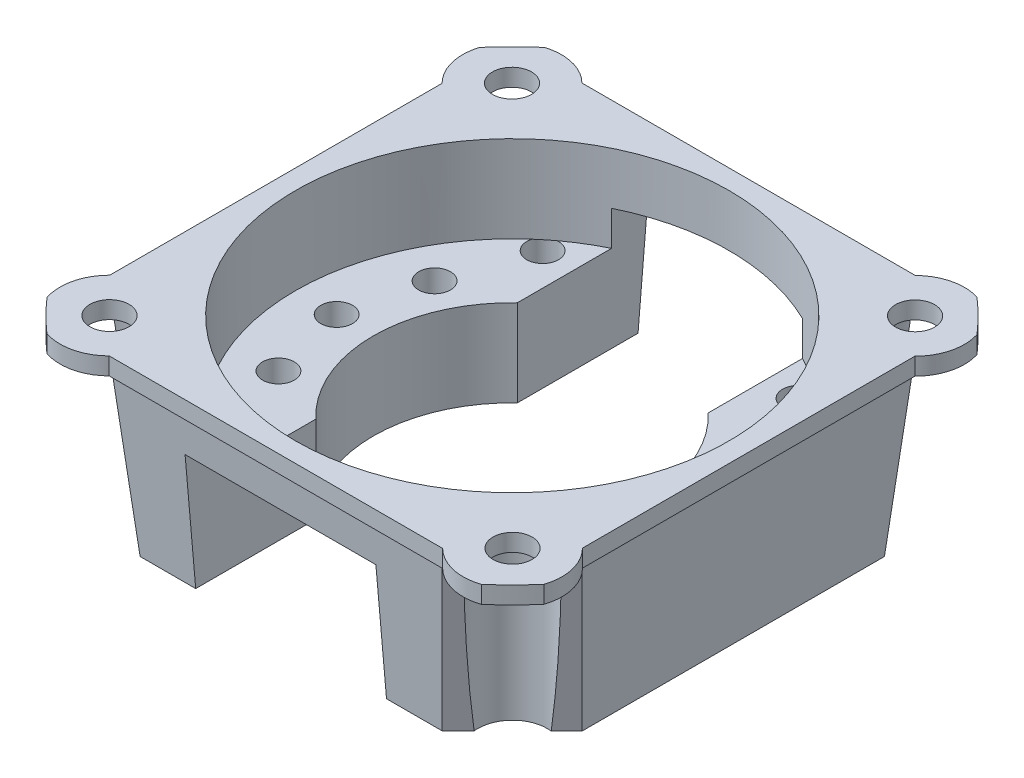
from build123d import *
from OCP.BRepFilletAPI import BRepFilletAPI_MakeChamfer

# Parameters (mm, degrees)
SKETCH1_W               = 29.5
SKETCH1_H               = 29.5
BOSS_EXTRUDE1_DEPTH     = 10
SKETCH2_R               = 12.5
CUT_EXTRUDE1_DEPTH      = 5
CHAMFER1_SIZE           = 22.860104606
CHAMFER1_SIZE_2         = 2
CHAMFER2_SIZE           = 4
CHAMFER2_SIZE2          = 4.030734246
SKETCH5_R               = 8
CUT_EXTRUDE2_DEPTH      = 10
BOSS_EXTRUDE2_START     = -1
BOSS_EXTRUDE2_DEPTH     = 1
MIRROR2_START           = -1
MIRROR2_COPY_1_DEPTH    = 1
CUT_EXTRUDE3_DEPTH      = 43.277768842
CUT_EXTRUDE3_DEPTH_BACK = 43.277768842
SKETCH7_R               = 1.125
SKETCH8_R               = 0.635
CUT_EXTRUDE4_DEPTH      = 43.501879232
SKETCH10_R              = 0.915
CUT_EXTRUDE5_DEPTH      = 2
SKETCH11_OUTSIDE_W      = 39.354
SKETCH11_OUTSIDE_H      = 39.324
SKETCH11_OUTSIDE_R      = 19
CUT_EXTRUDE6_DEPTH      = 43.501879232
SKETCH12_R              = 2
CUT_EXTRUDE7_DEPTH      = 9
SKETCH13_W              = 11
SKETCH13_H              = 30.855989766
CUT_EXTRUDE8_DEPTH      = 7


with BuildPart() as part:
    # Sketch1 → Boss-Extrude1 (new body)
    with BuildSketch(Plane(origin=(0, 0, 0), x_dir=(1, 0, 0), z_dir=(0, 1, 0))):
        with Locations((14.75, 14.75)):
            Rectangle(SKETCH1_W, SKETCH1_H)
    extrude(amount=BOSS_EXTRUDE1_DEPTH)

    # Sketch2 → Cut-Extrude1 (cut)
    with BuildSketch(Plane(origin=(0, 10, 0), x_dir=(1, 0, 0), z_dir=(0, 1, 0))):
        with Locations(Location((14.75, 14.75, 0), (0, 0, 270))):
            Circle(SKETCH2_R)
    extrude(amount=-CUT_EXTRUDE1_DEPTH, mode=Mode.SUBTRACT)

    # Chamfer1
    # the kernel refuses this chamfer: 22.860104606, 2 mm, written as the material it takes off along each edge
    with BuildSketch(Plane(origin=(-59.427907001, 0, 0), x_dir=(0, 1, 0), z_dir=(1, 0, 0)), Plane(origin=(29.5, 0, 59.427907001), x_dir=(0, 1, 0), z_dir=(0, 0, -1)), Plane(origin=(0, 0, -88.927907001), x_dir=(0, 1, 0), z_dir=(0, 0, 1))) as chamfer1_piece_1:
        Polygon((CHAMFER1_SIZE, 0), (0, -CHAMFER1_SIZE_2), (0, 0), align=None)
    extrude(amount=148.355814002, mode=Mode.SUBTRACT)
    with BuildSketch(Plane(origin=(88.927907001, 0, -29.5), x_dir=(0, 0, 1), z_dir=(-1, 0, 0))) as chamfer1_piece_2:
        Polygon((CHAMFER1_SIZE_2, 0), (0, CHAMFER1_SIZE), (0, 0), align=None)
    extrude(amount=148.355814002, mode=Mode.SUBTRACT)

    # Chamfer2: one chamfer whose edges measure the first distance from different faces: ONE call of the kernel's chamfer builder (chamfer() names one face for all edges)
    chamfer2_edges_1 = [part.edges().sort_by_distance(p)[0] for p in [
        (1.562556682, 5, -27.937443318),
        (27.937443318, 5, -27.937443318),
    ]]
    chamfer2_side_1 = [part.faces().sort_by_distance(p)[0] for p in [
        (14.75, 5.055285333, -27.942280158),
    ]]
    chamfer2_edges_2 = [part.edges().sort_by_distance(p)[0] for p in [
        (1.562556682, 5, -1.562556682),
    ]]
    chamfer2_side_2 = [part.faces().sort_by_distance(p)[0] for p in [
        (1.557719842, 5.055285333, -14.75),
    ]]
    chamfer2_edges_3 = [part.edges().sort_by_distance(p)[0] for p in [
        (27.937443318, 5, -1.562556682),
    ]]
    chamfer2_side_3 = [part.faces().sort_by_distance(p)[0] for p in [
        (27.942280158, 5.055285333, -14.75),
    ]]
    chamfer2 = BRepFilletAPI_MakeChamfer(part.part.solid().wrapped)
    for e in chamfer2_edges_1:
        chamfer2.Add(CHAMFER2_SIZE, CHAMFER2_SIZE2, e.wrapped, chamfer2_side_1[0].wrapped)  # the first distance lies on this face
    for e in chamfer2_edges_2:
        chamfer2.Add(CHAMFER2_SIZE, CHAMFER2_SIZE2, e.wrapped, chamfer2_side_2[0].wrapped)  # the first distance lies on this face
    for e in chamfer2_edges_3:
        chamfer2.Add(CHAMFER2_SIZE, CHAMFER2_SIZE2, e.wrapped, chamfer2_side_3[0].wrapped)  # the first distance lies on this face
    add(Compound.cast(chamfer2.Shape()), mode=Mode.REPLACE)

    # Sketch5 → Cut-Extrude2 (cut)
    with BuildSketch(Plane.XZ):
        with Locations(Location((14.75, -14.734574622, 0), (0, 0, 270))):
            Circle(SKETCH5_R)
    extrude(amount=-CUT_EXTRUDE2_DEPTH, mode=Mode.SUBTRACT)

    # Boss-Extrude2: read off the stored shape, not the designer's step
    # Boss-Extrude2 outline → Boss-Extrude2 (add)
    with BuildSketch(Plane(origin=(0, 10, 0), x_dir=(1, 0, 0), z_dir=(0, 1, 0)).offset(BOSS_EXTRUDE2_START)):
        with BuildLine():
            Line((1.125113365, 5.14027687), (5.171127626, 1.125113365))
            Line((5.171127626, 1.125113365), (24.328872374, 1.125113365))
            Line((24.328872374, 1.125113365), (28.374886635, 5.14027687))
            Line((28.374886635, 5.14027687), (28.374886635, 24.328872374))
            Line((28.374886635, 24.328872374), (24.35972313, 28.374886635))
            Line((24.35972313, 28.374886635), (5.14027687, 28.374886635))
            ThreePointArc((5.14027687, 28.374886635), (1.109687987, 28.359461258), (1.125113365, 24.328872374))
            Line((1.125113365, 24.328872374), (1.125113365, 5.14027687))
        make_face()
        Polygon((24.272234466, 28.287397972), (28.287397972, 24.241383711), (28.287397972, 5.227765534), (24.241383711, 1.212602028), (5.258616289, 1.212602028), (1.212602028, 5.227765534), (1.212602028, 24.241383711), (5.227765534, 28.287397972), align=None, mode=Mode.SUBTRACT)
    boss_extrude2 = extrude(amount=BOSS_EXTRUDE2_DEPTH)

    # Mirror1: Boss-Extrude2 across plane
    add(boss_extrude2.mirror(Plane(origin=(14.75, 0, 0), x_dir=(0, 0, 1), z_dir=(1, 0, 0))))

    # Mirror2: Boss-Extrude2 across plane
    add(boss_extrude2.mirror(Plane.XY.offset(-14.75)))

    # Mirror2 copy 1 sketch → Mirror2 copy 1 (add)
    with BuildSketch(Plane(origin=(29.5, 10, -29.5), x_dir=(-1, 0, 0), z_dir=(0, 1, 0)).offset(MIRROR2_START)):
        with BuildLine():
            Line((1.125113365, 5.14027687), (5.171127626, 1.125113365))
            Line((5.171127626, 1.125113365), (24.328872374, 1.125113365))
            Line((24.328872374, 1.125113365), (28.374886635, 5.14027687))
            Line((28.374886635, 5.14027687), (28.374886635, 24.328872374))
            Line((28.374886635, 24.328872374), (24.35972313, 28.374886635))
            Line((24.35972313, 28.374886635), (5.14027687, 28.374886635))
            ThreePointArc((5.14027687, 28.374886635), (1.109687987, 28.359461258), (1.125113365, 24.328872374))
            Line((1.125113365, 24.328872374), (1.125113365, 5.14027687))
        make_face()
        Polygon((24.272234466, 28.287397972), (28.287397972, 24.241383711), (28.287397972, 5.227765534), (24.241383711, 1.212602028), (5.258616289, 1.212602028), (1.212602028, 5.227765534), (1.212602028, 24.241383711), (5.227765534, 28.287397972), align=None, mode=Mode.SUBTRACT)
    extrude(amount=MIRROR2_COPY_1_DEPTH)

    # Sketch7 → Cut-Extrude3 (cut, two sides: drawn at the far end of the back side and taken through both)
    with BuildSketch(Plane.XZ.offset(-9).offset(-CUT_EXTRUDE3_DEPTH_BACK)):
        with Locations(Location((3.132695117, -3.148120495, 0), (0, 0, 270))):
            Circle(SKETCH7_R)
        with Locations(Location((26.367304883, -3.148120495, 0), (0, 0, 308.909428046))):
            Circle(SKETCH7_R)
        with Locations(Location((26.367304883, -26.351879505, 0), (0, 0, 270))):
            Circle(SKETCH7_R)
        with Locations(Location((3.132695117, -26.351879505, 0), (0, 0, 270))):
            Circle(SKETCH7_R)
    extrude(amount=CUT_EXTRUDE3_DEPTH + CUT_EXTRUDE3_DEPTH_BACK, mode=Mode.SUBTRACT)

    # Sketch8 → Cut-Extrude4 (cut, through all)
    with BuildSketch(Plane.XZ):
        with Locations(Location((7.375113365, -5.625113365, 0), (0, 0, 270))):
            Circle(SKETCH8_R)
        with Locations(Location((7.375113365, -23.874886635, 0), (0, 0, 270))):
            Circle(SKETCH8_R)
        with Locations(Location((4.625113365, -14.75, 0), (0, 0, 270))):
            Circle(SKETCH8_R)
        with Locations(Location((22.124886635, -23.874886635, 0), (0, 0, 90))):
            Circle(SKETCH8_R)
        with Locations(Location((24.874886635, -14.75, 0), (0, 0, 90))):
            Circle(SKETCH8_R)
        with Locations(Location((22.124886635, -5.625113365, 0), (0, 0, 90))):
            Circle(SKETCH8_R)
        with Locations(Location((5.770249527, -10.25, 0), (0, 0, 270))):
            Circle(SKETCH8_R)
        with Locations(Location((5.770249527, -19.25, 0), (0, 0, 90))):
            Circle(SKETCH8_R)
        with Locations(Location((23.729750473, -10.25, 0), (0, 0, 90))):
            Circle(SKETCH8_R)
        with Locations(Location((23.729750473, -19.25, 0), (0, 0, 270))):
            Circle(SKETCH8_R)
    extrude(amount=-CUT_EXTRUDE4_DEPTH, mode=Mode.SUBTRACT)

    # Sketch10 → Cut-Extrude5 (cut)
    with BuildSketch(Plane(origin=(0, 5, 0), x_dir=(1, 0, 0), z_dir=(0, 1, 0))):
        with Locations(Location((7.375113365, 23.874886635, 0), (0, 0, 270))):
            Circle(SKETCH10_R)
        with Locations(Location((4.625113365, 14.75, 0), (0, 0, 270))):
            Circle(SKETCH10_R)
        with Locations(Location((7.375113365, 5.625113365, 0), (0, 0, 270))):
            Circle(SKETCH10_R)
        with Locations(Location((22.124886635, 5.625113365, 0), (0, 0, 270))):
            Circle(SKETCH10_R)
        with Locations(Location((24.874886635, 14.75, 0), (0, 0, 270))):
            Circle(SKETCH10_R)
        with Locations(Location((22.124886635, 23.874886635, 0), (0, 0, 270))):
            Circle(SKETCH10_R)
        with Locations(Location((5.770249527, 19.25, 0), (0, 0, 270))):
            Circle(SKETCH10_R)
        with Locations(Location((5.770249527, 10.25, 0), (0, 0, 270))):
            Circle(SKETCH10_R)
        with Locations(Location((23.729750473, 10.25, 0), (0, 0, 270))):
            Circle(SKETCH10_R)
        with Locations(Location((23.729750473, 19.25, 0), (0, 0, 270))):
            Circle(SKETCH10_R)
    extrude(amount=-CUT_EXTRUDE5_DEPTH, mode=Mode.SUBTRACT)

    # Sketch11 outside → Cut-Extrude6 (cut, through all)
    with BuildSketch(Plane.XZ):
        with Locations((14.75, -14.75)):
            Rectangle(SKETCH11_OUTSIDE_W, SKETCH11_OUTSIDE_H)
        with Locations((14.75, -14.734574622)):
            Circle(SKETCH11_OUTSIDE_R, mode=Mode.SUBTRACT)
    extrude(amount=-CUT_EXTRUDE6_DEPTH, mode=Mode.SUBTRACT)

    # Sketch12 → Cut-Extrude7 (cut)
    with BuildSketch(Plane.XZ):
        with Locations((3.132695117, -3.148120495)):
            Circle(SKETCH12_R)
        with Locations((26.367304883, -3.148120495)):
            Circle(SKETCH12_R)
        with Locations((26.367304883, -26.351879505)):
            Circle(SKETCH12_R)
        with Locations((3.132695117, -26.351879505)):
            Circle(SKETCH12_R)
    extrude(amount=-CUT_EXTRUDE7_DEPTH, mode=Mode.SUBTRACT)

    # Sketch13 → Cut-Extrude8 (cut)
    with BuildSketch(Plane.XZ):
        with Locations((14.75, -15.427994883)):
            Rectangle(SKETCH13_W, SKETCH13_H)
    extrude(amount=-CUT_EXTRUDE8_DEPTH, mode=Mode.SUBTRACT)


solid = part.part
